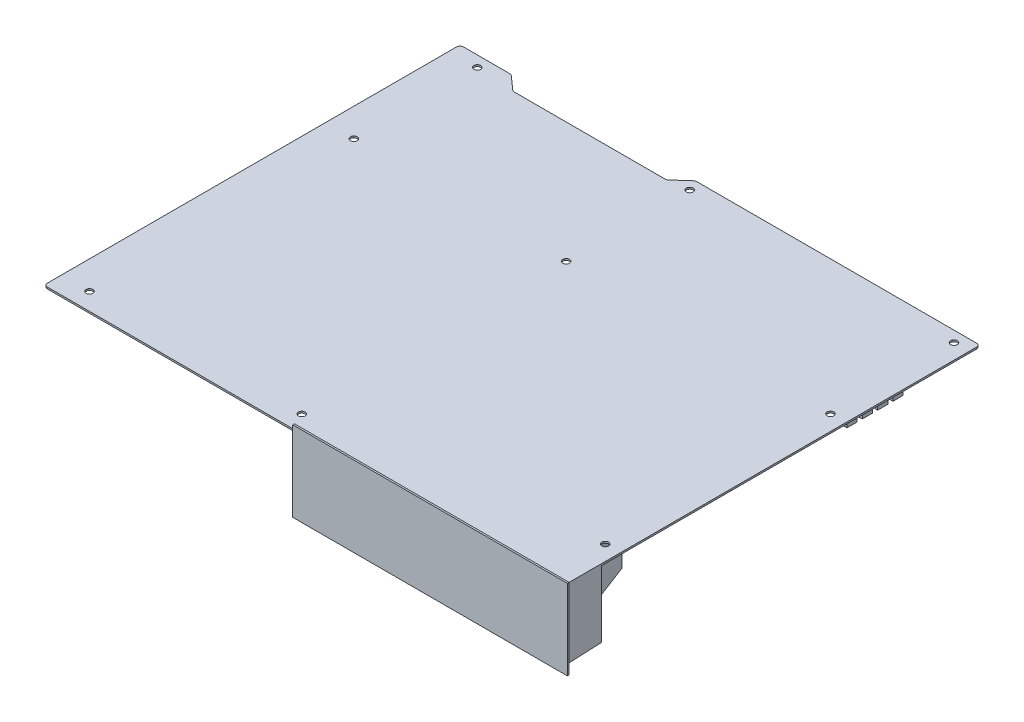
from build123d import *

# Parameters (mm, degrees)
SKETCH1_R           = 1.9812
BOSS_EXTRUDE1_DEPTH = 1
FILLET1_R           = 2
FILLET2_R           = 2
BOSS_EXTRUDE2_DEPTH = 40
SKETCH3_W           = 161
SKETCH3_H           = 47
BOSS_EXTRUDE3_DEPTH = 1
CUT_EXTRUDE1_DEPTH  = 225
SKETCH5_W           = 140
SKETCH5_H           = 6
BOSS_EXTRUDE4_DEPTH = 5
SKETCH6_W           = 6
SKETCH6_H           = 6
BOSS_EXTRUDE5_DEPTH = 12
SKETCH7_W           = 135
SKETCH7_H           = 1.5
CUT_EXTRUDE2_DEPTH  = 15
LPATTERN2_COUNT     = 4
LPATTERN2_PITCH     = 9
SKETCH8_W           = 6
SKETCH8_H           = 89
SKETCH8_W_2         = 2
SKETCH8_H_2         = 85
BOSS_EXTRUDE6_DEPTH = 12
SKETCH9_W           = 35
SKETCH9_H           = 30
BOSS_EXTRUDE7_DEPTH = 4


with BuildPart() as part:
    # Sketch1 → Boss-Extrude1 (new body)
    with BuildSketch(Plane(origin=(0, 0, 0), x_dir=(1, 0, 0), z_dir=(0, 1, 0))):
        Polygon((-152.4, 121.92), (-152.4, -121.92), (152.4, -121.92), (152.4, 121.92), (-14.4, 121.92), (-23.4, 113.92), (-113.4, 113.92), (-122.4, 121.92), align=None)
        with Locations((-11.43, -111.76)):
            Circle(SKETCH1_R, mode=Mode.SUBTRACT)
        with Locations((143.51, -88.9)):
            Circle(SKETCH1_R, mode=Mode.SUBTRACT)
        with Locations((-135.89, 43.18)):
            Circle(SKETCH1_R, mode=Mode.SUBTRACT)
        with Locations((-11.43, 115.57)):
            Circle(SKETCH1_R, mode=Mode.SUBTRACT)
        with Locations((-135.89, 115.57)):
            Circle(SKETCH1_R, mode=Mode.SUBTRACT)
        with Locations((143.51, 115.57)):
            Circle(SKETCH1_R, mode=Mode.SUBTRACT)
        with Locations((-135.89, -111.76)):
            Circle(SKETCH1_R, mode=Mode.SUBTRACT)
        with Locations((143.51, 43.18)):
            Circle(SKETCH1_R, mode=Mode.SUBTRACT)
        with Locations((-11.43, 43.18)):
            Circle(SKETCH1_R, mode=Mode.SUBTRACT)
    extrude(amount=BOSS_EXTRUDE1_DEPTH)

    # Fillet1
    fillet1_edges = [part.edges().sort_by_distance(p)[0] for p in [
        (-14.4, 0.5, -121.92),
        (-23.4, 0.5, -113.92),
        (-122.4, 0.5, -121.92),
        (-113.4, 0.5, -113.92),
    ]]
    fillet(fillet1_edges, radius=FILLET1_R)

    # Fillet2
    fillet2_edges = [part.edges().sort_by_distance(p)[0] for p in [
        (-152.4, 0.5, 121.92),
        (152.4, 0.5, -121.92),
        (-152.4, 0.5, -121.92),
    ]]
    fillet(fillet2_edges, radius=FILLET2_R)

    # Sketch2 → Boss-Extrude2 (add)
    with BuildSketch(Plane.XZ):
        Polygon((-2.6, 121.92), (152.4, 121.92), (152.4, 99.92), (134.319980014, 91.369393161), (122.529319933, 57.92), (24.529319933, 57.92), (-2.6, 99.92), align=None)
    extrude(amount=BOSS_EXTRUDE2_DEPTH)

    # Sketch3 → Boss-Extrude3 (add)
    with BuildSketch(Plane.XY.offset(121.92)):
        with Locations((74.9, -19.5)):
            Rectangle(SKETCH3_W, SKETCH3_H)
    extrude(amount=BOSS_EXTRUDE3_DEPTH)

    # Sketch4 → Cut-Extrude1 (cut, symmetric)
    with BuildSketch(Plane(origin=(0, 0, 0), x_dir=(0, 0, -1), z_dir=(1, 0, 0))):
        Polygon((-55.675354563, -37), (-121.92, -40), (-121.92, -43.768992378), (-55.675354563, -43.768992378), align=None)
    extrude(amount=CUT_EXTRUDE1_DEPTH, both=True, mode=Mode.SUBTRACT)

    # Sketch5 → Boss-Extrude4 (add)
    with BuildSketch(Plane.XZ):
        with Locations((67.4, -88.92)):
            Rectangle(SKETCH5_W, SKETCH5_H)
    boss_extrude4 = extrude(amount=BOSS_EXTRUDE4_DEPTH)

    # Sketch6 → Boss-Extrude5 (add)
    with BuildSketch(Plane.XZ.offset(5)):
        with Locations((134.4, -88.92)):
            Rectangle(SKETCH6_W, SKETCH6_H)
        with Locations((0.4, -88.92)):
            Rectangle(SKETCH6_W, SKETCH6_H)
    boss_extrude5 = extrude(amount=BOSS_EXTRUDE5_DEPTH)

    # Sketch7 → Cut-Extrude2 (cut)
    with BuildSketch(Plane.XZ.offset(17)):
        with Locations((67.4, -88.92)):
            Rectangle(SKETCH7_W, SKETCH7_H)
    cut_extrude2 = extrude(amount=-CUT_EXTRUDE2_DEPTH, mode=Mode.SUBTRACT)

    # LPattern2: Boss-Extrude4, Boss-Extrude5, Cut-Extrude2 ×4
    with Locations(*[(0, 0, i * LPATTERN2_PITCH) for i in range(1, LPATTERN2_COUNT)]):
        add(boss_extrude4)
        add(boss_extrude5)
        add(cut_extrude2, mode=Mode.SUBTRACT)

    # Sketch8 → Boss-Extrude6 (add)
    with BuildSketch(Plane.XZ):
        with Locations((-32.4, 56.898062251)):
            Rectangle(SKETCH8_W, SKETCH8_H)
        with Locations((-32.4, 56.898062251)):
            Rectangle(SKETCH8_W_2, SKETCH8_H_2, mode=Mode.SUBTRACT)
    extrude(amount=BOSS_EXTRUDE6_DEPTH)

    # Sketch9 → Boss-Extrude7 (add)
    with BuildSketch(Plane.XZ):
        with Locations((54.9, 6.08)):
            Rectangle(SKETCH9_W, SKETCH9_H)
    extrude(amount=BOSS_EXTRUDE7_DEPTH)


solid = part.part
